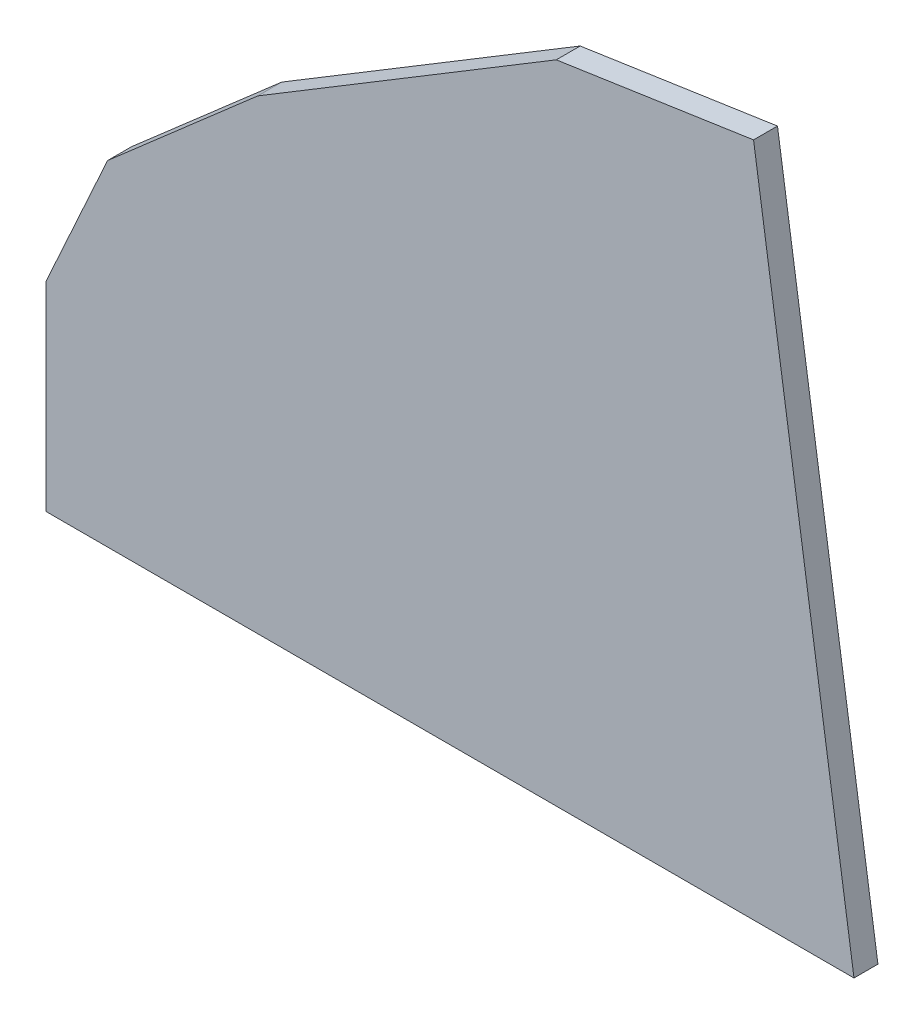
from build123d import *

# Parameters (mm, degrees)
SM_BASE_FLANGE_1_DEPTH = 6


# Sheet-metal steps are written as plain solids
with BuildPart() as part:
    # Sketch 1 → Базовая кромка1 (new body)
    with BuildSketch(Plane.XY):
        Polygon((-207.414598297, 166.780168175), (-245.088489453, 133.906502041), (-260.502189932, 100), (-260.502189932, 50), (-57.98187967, 50), (-83.157025012, 219.358975323), (-132.613596936, 212.007275279), align=None)
    extrude(amount=-SM_BASE_FLANGE_1_DEPTH)


solid = part.part
